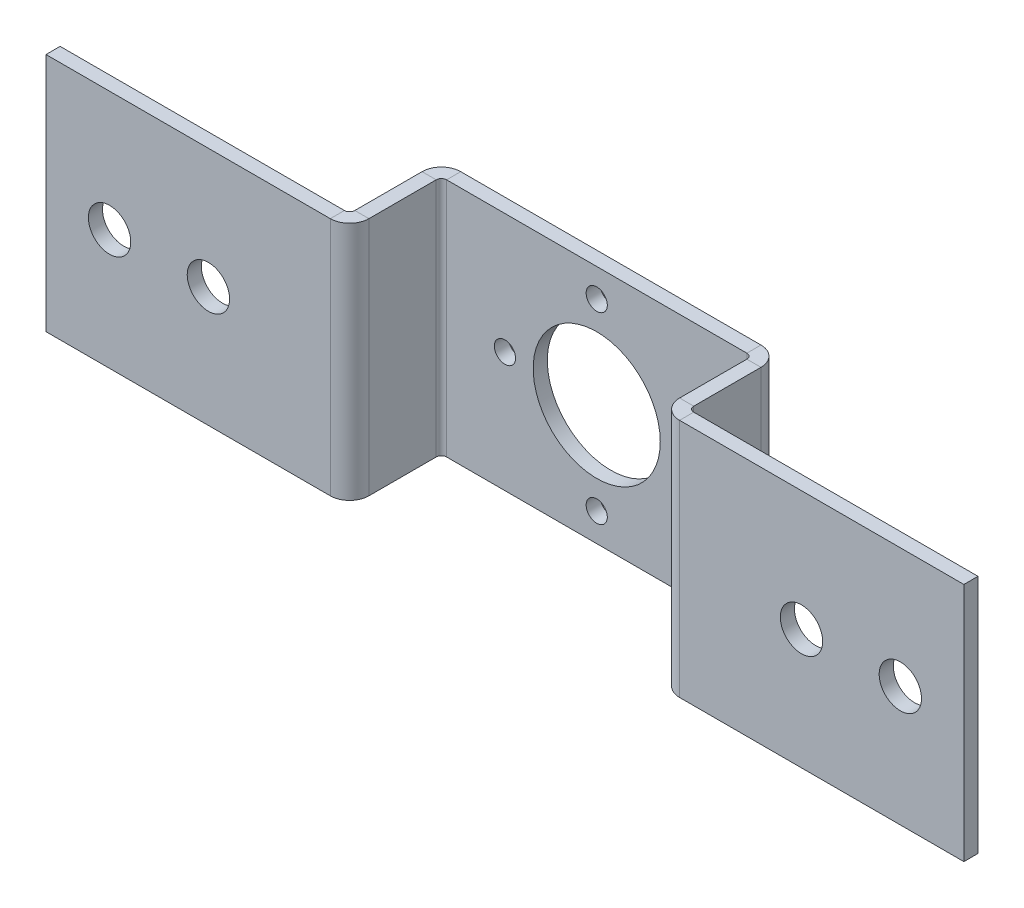
from build123d import *

# Parameters (mm, degrees)
SKETCH1_W                      = 44
SKETCH1_H                      = 34
SKETCH1_R                      = 9
SKETCH1_R_2                    = 1.5
BASE_FLANGE1_DEPTH             = 2
EDGE_FLANGE1_STRIP_W           = 9.4732
EDGE_FLANGE1_STRIP_H           = 2
EDGE_FLANGE1_STRIP_CUT_DEPTH   = 34
EDGE_FLANGE1_STRIP_2_W         = 9.4732
EDGE_FLANGE1_STRIP_2_H         = 2
EDGE_FLANGE1_STRIP_CUT_2_DEPTH = 34
EDGE_FLANGE1_DEPTH             = 34
EDGE_FLANGE1_BEND_DEPTH        = 34
EDGE_FLANGE2_STRIP_W           = 9.4732
EDGE_FLANGE2_STRIP_H           = 2
EDGE_FLANGE2_STRIP_CUT_DEPTH   = 34
EDGE_FLANGE2_STRIP_2_W         = 9.4732
EDGE_FLANGE2_STRIP_2_H         = 2
EDGE_FLANGE2_STRIP_CUT_2_DEPTH = 34
EDGE_FLANGE2_DEPTH             = 34
EDGE_FLANGE2_BEND_DEPTH        = 34
SKETCH18_R                     = 3
CUT_EXTRUDE1_DEPTH             = 10


# Sheet-metal steps are written as plain solids
with BuildPart() as part:
    # Sketch1 → Base-Flange1 (new body)
    with BuildSketch(Plane.XY):
        Rectangle(SKETCH1_W, SKETCH1_H)
        Circle(SKETCH1_R, mode=Mode.SUBTRACT)
        with Locations((0, 13)):
            Circle(SKETCH1_R_2, mode=Mode.SUBTRACT)
        with Locations((13, 0)):
            Circle(SKETCH1_R_2, mode=Mode.SUBTRACT)
        with Locations((0, -13)):
            Circle(SKETCH1_R_2, mode=Mode.SUBTRACT)
        with Locations((-13, 0)):
            Circle(SKETCH1_R_2, mode=Mode.SUBTRACT)
    extrude(amount=-BASE_FLANGE1_DEPTH)

    # Edge-Flange1 strip (across the edge) → Edge-Flange1 strip cut (cut)
    with BuildSketch(Plane(origin=(-22, 17, 0), x_dir=(1, 0, 0), z_dir=(0, -1, 0))):
        with Locations((-4, -1)):
            Rectangle(EDGE_FLANGE1_STRIP_W, EDGE_FLANGE1_STRIP_H)
    extrude(amount=EDGE_FLANGE1_STRIP_CUT_DEPTH, mode=Mode.SUBTRACT)

    # Edge-Flange1 strip 2 (across the edge) → Edge-Flange1 strip cut 2 (cut)
    with BuildSketch(Plane(origin=(22, -17, 0), x_dir=(-1, 0, 0), z_dir=(0, 1, 0))):
        with Locations((-4, -1)):
            Rectangle(EDGE_FLANGE1_STRIP_2_W, EDGE_FLANGE1_STRIP_2_H)
    extrude(amount=EDGE_FLANGE1_STRIP_CUT_2_DEPTH, mode=Mode.SUBTRACT)

    # Edge-Flange1 section (across the edge) → Edge-Flange1 (add)
    with BuildSketch(Plane(origin=(-22, 17, 0), x_dir=(1, 0, 0), z_dir=(0, -1, 0))):
        with BuildLine():
            Line((-2, 0.7366), (-2, 11))
            Line((-2, 11), (0, 11))
            Line((0, 11), (0, 0.7366))
            ThreePointArc((0, 0.7366), (0.215745145, 0.215745145), (0.7366, 0))
            Line((0.7366, 0), (0.7366, -2))
            ThreePointArc((0.7366, -2), (-1.198468417, -1.198468417), (-2, 0.7366))
        make_face()
    extrude(amount=EDGE_FLANGE1_DEPTH)

    # Edge-Flange1 section 2 (across the edge) → Edge-Flange1 bend (add)
    with BuildSketch(Plane(origin=(22, -17, 0), x_dir=(-1, 0, 0), z_dir=(0, 1, 0))):
        with BuildLine():
            Line((-2, 0.7366), (-2, 11))
            Line((-2, 11), (0, 11))
            Line((0, 11), (0, 0.7366))
            ThreePointArc((0, 0.7366), (0.215745145, 0.215745145), (0.7366, 0))
            Line((0.7366, 0), (0.7366, -2))
            ThreePointArc((0.7366, -2), (-1.198468417, -1.198468417), (-2, 0.7366))
        make_face()
    extrude(amount=EDGE_FLANGE1_BEND_DEPTH)

    # Edge-Flange2 strip (across the edge) → Edge-Flange2 strip cut (cut)
    with BuildSketch(Plane(origin=(-24, -17, 11), x_dir=(0, 0, -1), z_dir=(0, 1, 0))):
        with Locations((-4, -1)):
            Rectangle(EDGE_FLANGE2_STRIP_W, EDGE_FLANGE2_STRIP_H)
    extrude(amount=EDGE_FLANGE2_STRIP_CUT_DEPTH, mode=Mode.SUBTRACT)

    # Edge-Flange2 strip 2 (across the edge) → Edge-Flange2 strip cut 2 (cut)
    with BuildSketch(Plane(origin=(24, 17, 11), x_dir=(0, 0, -1), z_dir=(0, -1, 0))):
        with Locations((-4, -1)):
            Rectangle(EDGE_FLANGE2_STRIP_2_W, EDGE_FLANGE2_STRIP_2_H)
    extrude(amount=EDGE_FLANGE2_STRIP_CUT_2_DEPTH, mode=Mode.SUBTRACT)

    # Edge-Flange2 section (across the edge) → Edge-Flange2 (add)
    with BuildSketch(Plane(origin=(-24, -17, 11), x_dir=(0, 0, -1), z_dir=(0, 1, 0))):
        with BuildLine():
            Line((-2, 0.7366), (-2, 41))
            Line((-2, 41), (0, 41))
            Line((0, 41), (0, 0.7366))
            ThreePointArc((0, 0.7366), (0.215745145, 0.215745145), (0.7366, 0))
            Line((0.7366, 0), (0.7366, -2))
            ThreePointArc((0.7366, -2), (-1.198468417, -1.198468417), (-2, 0.7366))
        make_face()
    extrude(amount=EDGE_FLANGE2_DEPTH)

    # Edge-Flange2 section 2 (across the edge) → Edge-Flange2 bend (add)
    with BuildSketch(Plane(origin=(24, 17, 11), x_dir=(0, 0, -1), z_dir=(0, -1, 0))):
        with BuildLine():
            Line((-2, 0.7366), (-2, 41))
            Line((-2, 41), (0, 41))
            Line((0, 41), (0, 0.7366))
            ThreePointArc((0, 0.7366), (0.215745145, 0.215745145), (0.7366, 0))
            Line((0.7366, 0), (0.7366, -2))
            ThreePointArc((0.7366, -2), (-1.198468417, -1.198468417), (-2, 0.7366))
        make_face()
    extrude(amount=EDGE_FLANGE2_BEND_DEPTH)

    # Sketch18 → Cut-Extrude1 (cut)
    with BuildSketch(Plane(origin=(0, 0, 11), x_dir=(-1, 0, 0), z_dir=(0, 0, -1))):
        with Locations((56, 0)):
            Circle(SKETCH18_R)
        with Locations((42, 0)):
            Circle(SKETCH18_R)
        with Locations((-56, 0)):
            Circle(SKETCH18_R)
        with Locations((-42, 0)):
            Circle(SKETCH18_R)
    extrude(amount=-CUT_EXTRUDE1_DEPTH, mode=Mode.SUBTRACT)


solid = part.part
